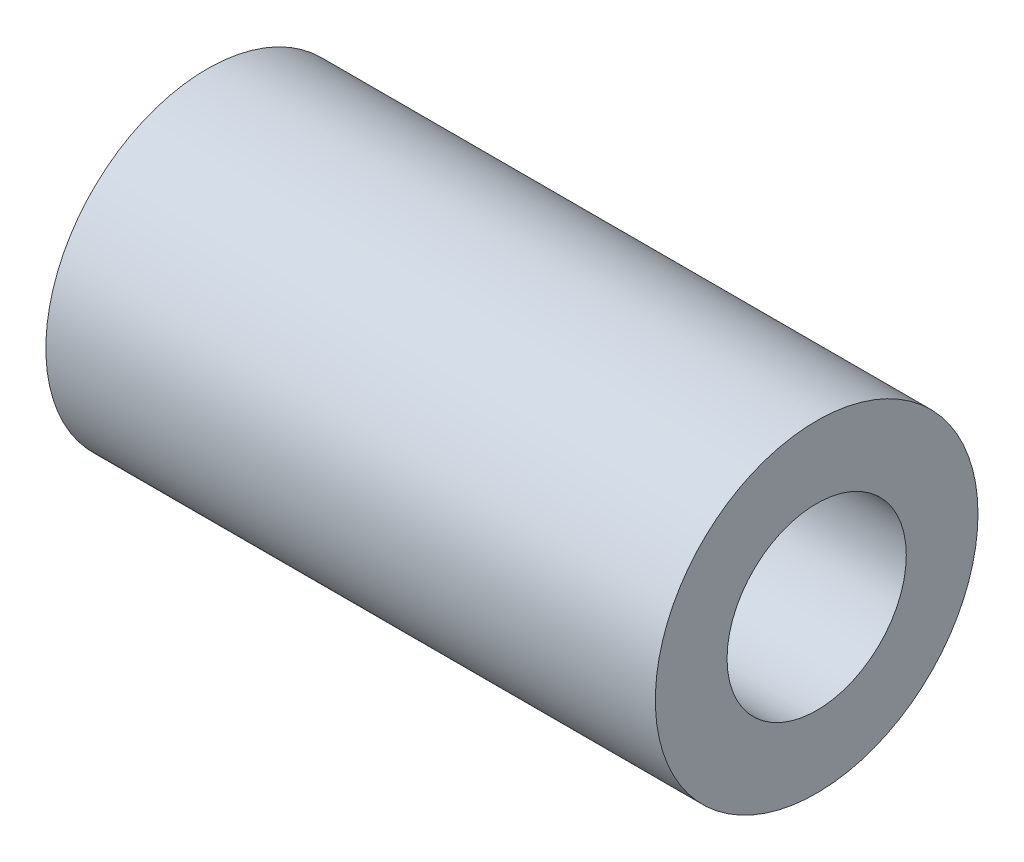
from build123d import *

# Parameters (mm, degrees)
SKETCH1_R           = 4.5
SKETCH1_R_2         = 2.5
BOSS_EXTRUDE1_DEPTH = 17


with BuildPart() as part:
    # Sketch1 → Boss-Extrude1 (new body)
    with BuildSketch(Plane(origin=(0, 0, 0), x_dir=(0, 0, -1), z_dir=(1, 0, 0))):
        Circle(SKETCH1_R)
        Circle(SKETCH1_R_2, mode=Mode.SUBTRACT)
    extrude(amount=BOSS_EXTRUDE1_DEPTH)


solid = part.part
